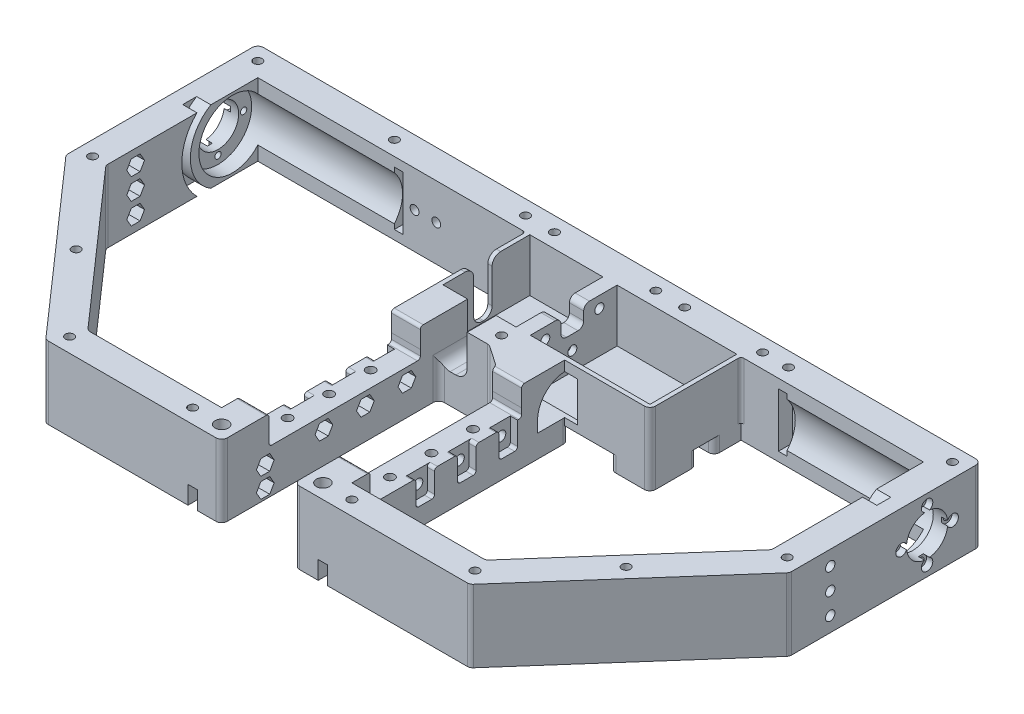
from build123d import *

# Parameters (mm, degrees)
BOSS_EXTRUDE1_DEPTH                     = 25.4
CUT_EXTRUDE1_REACH                      = 200.071
SKETCH3_R                               = 7.25
CUT_EXTRUDE2_DEPTH                      = 5.08
CUT_EXTRUDE3_START                      = -5.08
SKETCH4_R                               = 7.25
CUT_EXTRUDE3_DEPTH                      = 5.08
SKETCH5_R                               = 11.8
CUT_EXTRUDE4_DEPTH                      = 53
CUT_EXTRUDE5_START                      = -53
SKETCH6_R                               = 11.8
CUT_EXTRUDE5_DEPTH                      = 53
SKETCH9_W                               = 3
SKETCH9_H                               = 19
CUT_EXTRUDE8_DEPTH                      = 5
CUT_EXTRUDE9_DEPTH                      = 5
CUT_EXTRUDE10_START                     = -5
CUT_EXTRUDE10_DEPTH                     = 5
CBORE_FOR_M3_SBHCS1_D                   = 2.2
CBORE_FOR_M3_SBHCS1_DEPTH               = 5.08
CBORE_FOR_M3_SBHCS1_CBORE_D             = 4
CBORE_FOR_M3_SBHCS1_CBORE_DEPTH         = 2.2
CBORE_FOR_M3_SBHCS1_TIP                 = 0.660946681
CBORE_FOR_M3_SBHCS2_D                   = 2.2
CBORE_FOR_M3_SBHCS2_DEPTH               = 5.08
CBORE_FOR_M3_SBHCS2_CBORE_D             = 4
CBORE_FOR_M3_SBHCS2_CBORE_DEPTH         = 2.2
CBORE_FOR_M3_SBHCS2_TIP                 = 0.660946681
SKETCH17_W                              = 3.3
SKETCH17_H                              = 6.35
CUT_EXTRUDE11_DEPTH                     = 20.32
SKETCH19_W                              = 3.3
SKETCH19_H                              = 6.35
CUT_EXTRUDE12_DEPTH                     = 20.32
SKETCH20_W                              = 10.16
SKETCH20_H                              = 7.65
CUT_EXTRUDE13_DEPTH                     = 1.65
SKETCH21_W                              = 10.16
SKETCH21_H                              = 7.65
CUT_EXTRUDE14_DEPTH                     = 1.65
SKETCH22_R                              = 1.65
CUT_EXTRUDE15_DEPTH                     = 8.51
CUT_EXTRUDE16_START                     = -8.51
SKETCH23_R                              = 1.65
CUT_EXTRUDE16_DEPTH                     = 8.51
CUT_EXTRUDE17_DEPTH                     = 4.1
CUT_EXTRUDE18_DEPTH                     = 4.1
SKETCH26_R                              = 1.65
CUT_EXTRUDE19_DEPTH                     = 10.16
CUT_EXTRUDE20_START                     = -10.16
SKETCH27_R                              = 1.65
CUT_EXTRUDE20_DEPTH                     = 10.16
CUT_EXTRUDE21_DEPTH                     = 4.1
CUT_EXTRUDE22_DEPTH                     = 4.1
SKETCH30_W                              = 5
SKETCH30_H                              = 20
BOSS_EXTRUDE2_DEPTH                     = 30.479681711
CBORE_FOR_M3_SBHCS3_D                   = 3.2
CBORE_FOR_M3_SBHCS3_DEPTH               = 5
CBORE_FOR_M3_SBHCS3_CBORE_D             = 6
CBORE_FOR_M3_SBHCS3_CBORE_DEPTH         = 0.5
CBORE_FOR_M3_SBHCS3_TIP                 = 0.96137699
CBORE_FOR_M3_SBHCS4_D                   = 3.2
CBORE_FOR_M3_SBHCS4_DEPTH               = 5
CBORE_FOR_M3_SBHCS4_CBORE_D             = 6
CBORE_FOR_M3_SBHCS4_CBORE_DEPTH         = 3
CBORE_FOR_M3_SBHCS4_TIP                 = 0.96137699
SKETCH35_W                              = 8
SKETCH35_H                              = 7
CUT_EXTRUDE23_DEPTH                     = 5
FILLET1_R                               = 2
SKETCH36_W                              = 30.479681711
SKETCH36_H                              = 1.5
BOSS_EXTRUDE3_DEPTH                     = 27.16
SKETCH37_W                              = 1.5
SKETCH37_H                              = 30.479681711
BOSS_EXTRUDE4_DEPTH                     = 18.5
SKETCH38_W                              = 6.5
SKETCH38_H                              = 18
CUT_EXTRUDE24_DEPTH                     = 1.5
FILLET2_R                               = 3
SKETCH39_W                              = 30.479681711
SKETCH39_H                              = 1.5
BOSS_EXTRUDE5_DEPTH                     = 43.5
SKETCH40_W                              = 1.5
SKETCH40_H                              = 30.479681711
BOSS_EXTRUDE9_DEPTH                     = 18.5
SKETCH41_W                              = 29.940168914
SKETCH41_H                              = 1.5
BOSS_EXTRUDE7_DEPTH                     = 20
SKETCH42_W                              = 5
SKETCH42_H                              = 5
BOSS_EXTRUDE8_DEPTH                     = 5.4
SKETCH44_W                              = 18
SKETCH44_H                              = 14
CUT_EXTRUDE25_DEPTH                     = 11
F_1_0MM_DOWEL_HOLE1_D                   = 4.6
F_1_0MM_DOWEL_HOLE1_DEPTH               = 25.4
F_1_0MM_DOWEL_HOLE1_TIP                 = 1.381979424
F_1_0MM_DOWEL_HOLE2_D                   = 3.2
F_1_0MM_DOWEL_HOLE2_DEPTH               = 15.4
F_1_0MM_DOWEL_HOLE2_TIP                 = 0.96137699
SKETCH49_W                              = 10
SKETCH49_H                              = 15
CUT_EXTRUDE26_DEPTH                     = 10.16
FILLET4_R                               = 4
F_3_0MM_DOWEL_HOLE1_D                   = 3
F_3_0MM_DOWEL_HOLE1_DEPTH               = 25.4
F_3_0MM_DOWEL_HOLE1_TIP                 = 0.901290929
CBORE_FOR_M8_HEX_HEAD_BOLT1_D           = 3.1
CBORE_FOR_M8_HEX_HEAD_BOLT1_DEPTH       = 10.16
CBORE_FOR_M8_HEX_HEAD_BOLT1_CBORE_D     = 6
CBORE_FOR_M8_HEX_HEAD_BOLT1_CBORE_DEPTH = 5
CBORE_FOR_M8_HEX_HEAD_BOLT1_TIP         = 0.931333959
CUT_EXTRUDE27_DEPTH                     = 2.54
CUT_EXTRUDE28_START                     = -2.54
CUT_EXTRUDE28_DEPTH                     = 2.54
F_3_0MM_DOWEL_HOLE3_D                   = 3.4
F_3_0MM_DOWEL_HOLE3_DEPTH               = 7.62
F_3_0MM_DOWEL_HOLE3_TIP                 = 1.021463052
F_3_0MM_DOWEL_HOLE4_D                   = 3.4
F_3_0MM_DOWEL_HOLE4_DEPTH               = 7.62
F_3_0MM_DOWEL_HOLE4_TIP                 = 1.021463052
FILLET5_R                               = 1
FILLET6_R                               = 1
CUT_EXTRUDE29_DEPTH                     = 4.1
CUT_EXTRUDE30_DEPTH                     = 4.1
FILLET7_R                               = 1
SKETCH63_W                              = 75.66
SKETCH63_H                              = 9.479681711
BOSS_EXTRUDE10_DEPTH                    = 5.4
FILLET8_R                               = 2
FILLET9_R                               = 10


with BuildPart() as part:
    # Sketch1 → Boss-Extrude1 (new body)
    with BuildSketch(Plane(origin=(0, 0, 0), x_dir=(1, 0, 0), z_dir=(0, 1, 0))):
        Polygon((127, 0), (-127, 0), (-127, -67.34), (-74.439915543, -126.999681711), (-12.699915543, -126.999681711), (-12.699915543, -50.799681711), (5.082704288, -50.799681711), (12.699915543, -56.051038982), (12.699915543, -126.999681711), (74.439915543, -126.999681711), (127, -67.34), align=None)
        Polygon((-116.84, -10.16), (-116.84, -63.502882235), (-69.85036471, -116.839681711), (-22.859915543, -116.839681711), (-22.859915543, -40.639681711), (22.859915543, -40.639681711), (22.859915543, -116.839681711), (69.85036471, -116.839681711), (116.84, -63.502882235), (116.84, -10.16), align=None, mode=Mode.SUBTRACT)
    extrude(amount=BOSS_EXTRUDE1_DEPTH)

    # Cut-Extrude1: up to this face of the body (flat: up to its plane)
    cut_extrude1_end = Plane(part.part.faces().sort_by_distance((22.859915543, 12.7, 78.739681711))[0])
    # Sketch2 → Cut-Extrude1 (cut, up to the picked face)
    with BuildSketch(Plane.ZY.offset(22.859915543), mode=Mode.PRIVATE) as cut_extrude1_sk1:
        Polygon((57.248685399, 15.4), (110.390678023, 15.4), (110.393379129, 18.4), (110.393379129, 25.4), (57.245984293, 25.4), (57.245984293, 18.4), align=None)
    cut_extrude1_tool1 = split(extrude(cut_extrude1_sk1.sketch, amount=-CUT_EXTRUDE1_REACH, mode=Mode.PRIVATE), bisect_by=cut_extrude1_end, keep=Keep.BOTH, mode=Mode.PRIVATE)
    add(cut_extrude1_tool1.solids().sort_by(Axis((-22.859916, 20.400061, 83.819682), (1, 0, 0)))[0], mode=Mode.SUBTRACT)

    # Sketch3 → Cut-Extrude2 (cut)
    with BuildSketch(Plane(origin=(127, 0, 0), x_dir=(0, 0, -1), z_dir=(1, 0, 0))):
        with Locations((-19.05, 12.7)):
            Circle(SKETCH3_R)
    extrude(amount=-CUT_EXTRUDE2_DEPTH, mode=Mode.SUBTRACT)

    # Sketch4 → Cut-Extrude3 (cut)
    with BuildSketch(Plane.ZY.offset(127).offset(CUT_EXTRUDE3_START)):
        with Locations(Location((19.05, 12.7, 0), (0, 0, 180))):
            Circle(SKETCH4_R)
    extrude(amount=CUT_EXTRUDE3_DEPTH, mode=Mode.SUBTRACT)

    # Sketch5 → Cut-Extrude4 (cut)
    with BuildSketch(Plane(origin=(121.92, 0, 0), x_dir=(0, 0, -1), z_dir=(1, 0, 0))):
        with Locations((-19.05, 12.7)):
            Circle(SKETCH5_R)
    extrude(amount=-CUT_EXTRUDE4_DEPTH, mode=Mode.SUBTRACT)

    # Sketch6 → Cut-Extrude5 (cut)
    with BuildSketch(Plane.ZY.offset(121.92).offset(CUT_EXTRUDE5_START)):
        with Locations(Location((19.05, 12.7, 0), (0, 0, 180))):
            Circle(SKETCH6_R)
    extrude(amount=CUT_EXTRUDE5_DEPTH, mode=Mode.SUBTRACT)

    # Sketch9 → Cut-Extrude8 (cut)
    with BuildSketch(Plane.XY.offset(10.16)):
        with Locations((-67.42, 12.7)):
            Rectangle(SKETCH9_W, SKETCH9_H)
        with Locations((67.42, 12.7)):
            Rectangle(SKETCH9_W, SKETCH9_H)
    extrude(amount=-CUT_EXTRUDE8_DEPTH, mode=Mode.SUBTRACT)

    # Sketch10 → Cut-Extrude9 (cut)
    with BuildSketch(Plane.ZY.offset(-116.84)):
        with BuildLine():
            Line((31.52196857, 0), (26.649342077, 0))
            ThreePointArc((26.649342077, 0), (33.85, 12.7), (26.649342077, 25.4))
            Line((26.649342077, 25.4), (31.52196857, 25.4))
            ThreePointArc((31.52196857, 25.4), (36.85, 12.7), (31.52196857, 0))
        make_face()
    extrude(amount=-CUT_EXTRUDE9_DEPTH, mode=Mode.SUBTRACT)

    # Sketch11 → Cut-Extrude10 (cut)
    with BuildSketch(Plane(origin=(-116.84, 0, 0), x_dir=(0, 0, -1), z_dir=(1, 0, 0)).offset(CUT_EXTRUDE10_START)):
        with BuildLine():
            Line((-31.52196857, 0), (-26.649342077, 0))
            ThreePointArc((-26.649342077, 0), (-33.85, 12.7), (-26.649342077, 25.4))
            Line((-26.649342077, 25.4), (-31.52196857, 25.4))
            ThreePointArc((-31.52196857, 25.4), (-36.85, 12.7), (-31.52196857, 0))
        make_face()
    extrude(amount=CUT_EXTRUDE10_DEPTH, mode=Mode.SUBTRACT)

    # CBORE for M3 SBHCS1
    with Locations(Plane(origin=(127, 12.7, 28.05), x_dir=(0, 0, 1), z_dir=(1, 0, 0))):
        with Locations((0, 0), (-9, -9), (-18, 0), (-9, 9)):
            CounterBoreHole(CBORE_FOR_M3_SBHCS1_D / 2, CBORE_FOR_M3_SBHCS1_CBORE_D / 2, CBORE_FOR_M3_SBHCS1_CBORE_DEPTH, depth=CBORE_FOR_M3_SBHCS1_DEPTH)
            with Locations((0, 0, -(CBORE_FOR_M3_SBHCS1_DEPTH + CBORE_FOR_M3_SBHCS1_TIP / 2))):  # 118° drill point
                Cone(0, CBORE_FOR_M3_SBHCS1_D / 2, CBORE_FOR_M3_SBHCS1_TIP, mode=Mode.SUBTRACT)

    # CBORE for M3 SBHCS2
    with Locations(Plane(origin=(-127, 12.7, 28.05), x_dir=(0, 0, -1), z_dir=(-1, 0, 0))):
        with Locations((0, 0), (9, -9), (18, 0), (9, 9)):
            CounterBoreHole(CBORE_FOR_M3_SBHCS2_D / 2, CBORE_FOR_M3_SBHCS2_CBORE_D / 2, CBORE_FOR_M3_SBHCS2_CBORE_DEPTH, depth=CBORE_FOR_M3_SBHCS2_DEPTH)
            with Locations((0, 0, -(CBORE_FOR_M3_SBHCS2_DEPTH + CBORE_FOR_M3_SBHCS2_TIP / 2))):  # 118° drill point
                Cone(0, CBORE_FOR_M3_SBHCS2_D / 2, CBORE_FOR_M3_SBHCS2_TIP, mode=Mode.SUBTRACT)

    # Sketch17 → Cut-Extrude11 (cut)
    with BuildSketch(Plane.XY.offset(126.999681711)):
        with Locations((22.859915543, 3.175)):
            Rectangle(SKETCH17_W, SKETCH17_H)
    extrude(amount=-CUT_EXTRUDE11_DEPTH, mode=Mode.SUBTRACT)

    # Sketch19 → Cut-Extrude12 (cut)
    with BuildSketch(Plane.XY.offset(126.999681711)):
        with Locations((-22.859915543, 3.175)):
            Rectangle(SKETCH19_W, SKETCH19_H)
    extrude(amount=-CUT_EXTRUDE12_DEPTH, mode=Mode.SUBTRACT)

    # Sketch20 → Cut-Extrude13 (cut)
    with BuildSketch(Plane(origin=(22.859915543, 0, 0), x_dir=(0, 0, -1), z_dir=(1, 0, 0))):
        with Locations((-111.759681711, 10.175)):
            Rectangle(SKETCH20_W, SKETCH20_H)
    extrude(amount=-CUT_EXTRUDE13_DEPTH, mode=Mode.SUBTRACT)

    # Sketch21 → Cut-Extrude14 (cut)
    with BuildSketch(Plane.ZY.offset(22.859915543)):
        with Locations((111.759681711, 10.175)):
            Rectangle(SKETCH21_W, SKETCH21_H)
    extrude(amount=-CUT_EXTRUDE14_DEPTH, mode=Mode.SUBTRACT)

    # Sketch22 → Cut-Extrude15 (cut)
    with BuildSketch(Plane(origin=(21.209915543, 0, 0), x_dir=(0, 0, -1), z_dir=(1, 0, 0))):
        with Locations((-111.679681711, 3.5)):
            Circle(SKETCH22_R)
        with Locations((-111.679681711, 10.5)):
            Circle(SKETCH22_R)
    extrude(amount=-CUT_EXTRUDE15_DEPTH, mode=Mode.SUBTRACT)

    # Sketch23 → Cut-Extrude16 (cut)
    with BuildSketch(Plane.ZY.offset(21.209915543).offset(CUT_EXTRUDE16_START)):
        with Locations(Location((111.679681711, 3.5, 0), (0, 0, 180))):
            Circle(SKETCH23_R)
        with Locations(Location((111.679681711, 10.5, 0), (0, 0, 180))):
            Circle(SKETCH23_R)
    extrude(amount=CUT_EXTRUDE16_DEPTH, mode=Mode.SUBTRACT)

    # Sketch24 → Cut-Extrude17 (cut)
    with BuildSketch(Plane.ZY.offset(-12.699915543)):
        Polygon((114.797373165, 10.5), (113.238527438, 13.2), (110.120835984, 13.2), (108.561990258, 10.5), (110.120835984, 7.8), (113.238527438, 7.8), align=None)
        Polygon((114.797373165, 3.5), (113.238527438, 6.2), (110.120835984, 6.2), (108.561990258, 3.5), (110.120835984, 0.8), (113.238527438, 0.8), align=None)
    extrude(amount=-CUT_EXTRUDE17_DEPTH, mode=Mode.SUBTRACT)

    # Sketch25 → Cut-Extrude18 (cut)
    with BuildSketch(Plane(origin=(-12.699915543, 0, 0), x_dir=(0, 0, -1), z_dir=(1, 0, 0))):
        Polygon((-108.561990258, 10.5), (-110.120835984, 13.2), (-113.238527438, 13.2), (-114.797373165, 10.5), (-113.238527438, 7.8), (-110.120835984, 7.8), align=None)
        Polygon((-108.561990258, 3.5), (-110.120835984, 6.2), (-113.238527438, 6.2), (-114.797373165, 3.5), (-113.238527438, 0.8), (-110.120835984, 0.8), align=None)
    extrude(amount=-CUT_EXTRUDE18_DEPTH, mode=Mode.SUBTRACT)

    # Sketch26 → Cut-Extrude19 (cut)
    with BuildSketch(Plane(origin=(127, 0, 0), x_dir=(0, 0, -1), z_dir=(1, 0, 0))):
        with Locations((-53.05, 20.2)):
            Circle(SKETCH26_R)
        with Locations((-53.05, 12.7)):
            Circle(SKETCH26_R)
        with Locations((-53.05, 5.2)):
            Circle(SKETCH26_R)
    extrude(amount=-CUT_EXTRUDE19_DEPTH, mode=Mode.SUBTRACT)

    # Sketch27 → Cut-Extrude20 (cut)
    with BuildSketch(Plane.ZY.offset(127).offset(CUT_EXTRUDE20_START)):
        with Locations(Location((53.05, 20.2, 0), (0, 0, 180))):
            Circle(SKETCH27_R)
        with Locations(Location((53.05, 12.7, 0), (0, 0, 180))):
            Circle(SKETCH27_R)
        with Locations(Location((53.05, 5.2, 0), (0, 0, 180))):
            Circle(SKETCH27_R)
    extrude(amount=CUT_EXTRUDE20_DEPTH, mode=Mode.SUBTRACT)

    # Sketch28 → Cut-Extrude21 (cut)
    with BuildSketch(Plane.ZY.offset(-116.84)):
        Polygon((56.167691454, 20.2), (54.608845727, 22.9), (51.491154273, 22.9), (49.932308546, 20.2), (51.491154273, 17.5), (54.608845727, 17.5), align=None)
        Polygon((51.491154273, 15.4), (49.932308546, 12.7), (51.491154273, 10), (54.608845727, 10), (56.167691454, 12.7), (54.608845727, 15.4), align=None)
        Polygon((51.491154273, 7.9), (49.932308546, 5.2), (51.491154273, 2.5), (54.608845727, 2.5), (56.167691454, 5.2), (54.608845727, 7.9), align=None)
    extrude(amount=-CUT_EXTRUDE21_DEPTH, mode=Mode.SUBTRACT)

    # Sketch29 → Cut-Extrude22 (cut)
    with BuildSketch(Plane(origin=(-116.84, 0, 0), x_dir=(0, 0, -1), z_dir=(1, 0, 0))):
        Polygon((-49.932308546, 20.2), (-51.491154273, 22.9), (-54.608845727, 22.9), (-56.167691454, 20.2), (-54.608845727, 17.5), (-51.491154273, 17.5), align=None)
        Polygon((-56.167691454, 12.7), (-54.608845727, 10), (-51.491154273, 10), (-49.932308546, 12.7), (-51.491154273, 15.4), (-54.608845727, 15.4), align=None)
        Polygon((-56.167691454, 5.2), (-54.608845727, 2.5), (-51.491154273, 2.5), (-49.932308546, 5.2), (-51.491154273, 7.9), (-54.608845727, 7.9), align=None)
    extrude(amount=-CUT_EXTRUDE22_DEPTH, mode=Mode.SUBTRACT)

    # Sketch30 → Boss-Extrude2 (add)
    with BuildSketch(Plane(origin=(0, 0, 40.639681711), x_dir=(-1, 0, 0), z_dir=(0, 0, -1))):
        with Locations((-6.800084457, 15.4)):
            Rectangle(SKETCH30_W, SKETCH30_H)
    extrude(amount=BOSS_EXTRUDE2_DEPTH)

    # CBORE for M3 SBHCS3
    with Locations(Plane(origin=(4.300084457, 21.4, 35.399681711), x_dir=(0, -1, 0), z_dir=(-1, 0, 0))):
        with Locations((0, 0), (0, -19)):
            CounterBoreHole(CBORE_FOR_M3_SBHCS3_D / 2, CBORE_FOR_M3_SBHCS3_CBORE_D / 2, CBORE_FOR_M3_SBHCS3_CBORE_DEPTH, depth=CBORE_FOR_M3_SBHCS3_DEPTH)
            with Locations((0, 0, -(CBORE_FOR_M3_SBHCS3_DEPTH + CBORE_FOR_M3_SBHCS3_TIP / 2))):  # 118° drill point
                Cone(0, CBORE_FOR_M3_SBHCS3_D / 2, CBORE_FOR_M3_SBHCS3_TIP, mode=Mode.SUBTRACT)

    # CBORE for M3 SBHCS4
    with Locations(Plane(origin=(4.300084457, 13.4, 25.899681711), x_dir=(0, -1, 0), z_dir=(-1, 0, 0))):
        with Locations((0, 0)):
            CounterBoreHole(CBORE_FOR_M3_SBHCS4_D / 2, CBORE_FOR_M3_SBHCS4_CBORE_D / 2, CBORE_FOR_M3_SBHCS4_CBORE_DEPTH, depth=CBORE_FOR_M3_SBHCS4_DEPTH)
            with Locations((0, 0, -(CBORE_FOR_M3_SBHCS4_DEPTH + CBORE_FOR_M3_SBHCS4_TIP / 2))):  # 118° drill point
                Cone(0, CBORE_FOR_M3_SBHCS4_D / 2, CBORE_FOR_M3_SBHCS4_TIP, mode=Mode.SUBTRACT)

    # Sketch35 → Cut-Extrude23 (cut)
    with BuildSketch(Plane.ZY.offset(-4.300084457)):
        with Locations((25.899840856, 21.9)):
            Rectangle(SKETCH35_W, SKETCH35_H)
    extrude(amount=-CUT_EXTRUDE23_DEPTH, mode=Mode.SUBTRACT)

    # Fillet1
    fillet1_edges = [part.edges().sort_by_distance(p)[0] for p in [
        (6.800084457, 25.4, 21.899840856),
        (6.800084457, 25.4, 29.899840856),
        (6.800084457, 18.4, 29.899840856),
        (6.800084457, 18.4, 21.899840856),
    ]]
    fillet(fillet1_edges, radius=FILLET1_R)

    # Sketch36 → Boss-Extrude3 (add)
    with BuildSketch(Plane.ZY.offset(-4.300084457)):
        with Locations((25.399840856, 6.15)):
            Rectangle(SKETCH36_W, SKETCH36_H)
    extrude(amount=BOSS_EXTRUDE3_DEPTH)

    # Sketch37 → Boss-Extrude4 (add)
    with BuildSketch(Plane(origin=(0, 6.9, 0), x_dir=(1, 0, 0), z_dir=(0, 1, 0))):
        with Locations((-22.109915543, -25.399840856)):
            Rectangle(SKETCH37_W, SKETCH37_H)
    extrude(amount=BOSS_EXTRUDE4_DEPTH)

    # Sketch38 → Cut-Extrude24 (cut)
    with BuildSketch(Plane.ZY.offset(22.859915543)):
        with Locations((26.639681711, 16.4)):
            Rectangle(SKETCH38_W, SKETCH38_H)
    extrude(amount=-CUT_EXTRUDE24_DEPTH, mode=Mode.SUBTRACT)

    # Fillet2
    fillet2_edges = [part.edges().sort_by_distance(p)[0] for p in [
        (-22.109915543, 25.4, 23.389681711),
        (-22.109915543, 25.4, 29.889681711),
        (-22.109915543, 7.4, 29.889681711),
        (-22.109915543, 7.4, 23.389681711),
    ]]
    fillet(fillet2_edges, radius=FILLET2_R)



with BuildPart() as body_2:
    # Sketch39 → Boss-Extrude5 (new body)
    with BuildSketch(Plane(origin=(9.300084457, 0, 0), x_dir=(0, 0, -1), z_dir=(1, 0, 0))):
        with Locations((-25.399840856, 6.15)):
            Rectangle(SKETCH39_W, SKETCH39_H)
    extrude(amount=BOSS_EXTRUDE5_DEPTH)


with BuildPart() as part_1:
    add(part.part)

    add(body_2.part)  # Boss-Extrude9 merges body 2
    # Sketch40 → Boss-Extrude9 (add)
    with BuildSketch(Plane(origin=(0, 6.9, 0), x_dir=(1, 0, 0), z_dir=(0, 1, 0))):
        with Locations((52.050084457, -25.399840856)):
            Rectangle(SKETCH40_W, SKETCH40_H)
    extrude(amount=BOSS_EXTRUDE9_DEPTH)

    # Sketch41 → Boss-Extrude7 (add)
    with BuildSketch(Plane.XZ.offset(-5.4)):
        with Locations((37.83, 41.389681711)):
            Rectangle(SKETCH41_W, SKETCH41_H)
    extrude(amount=-BOSS_EXTRUDE7_DEPTH)

    # Sketch42 → Boss-Extrude8 (add)
    with BuildSketch(Plane.XZ.offset(-5.4)):
        with Locations((50.300084457, 39.639681711)):
            Rectangle(SKETCH42_W, SKETCH42_H)
    extrude(amount=BOSS_EXTRUDE8_DEPTH)

    # Sketch44 → Cut-Extrude25 (cut)
    with BuildSketch(Plane(origin=(0, 0, 40.639681711), x_dir=(-1, 0, 0), z_dir=(0, 0, -1))):
        with Locations((-18.300084457, 14.9)):
            Rectangle(SKETCH44_W, SKETCH44_H)
    extrude(amount=-CUT_EXTRUDE25_DEPTH, mode=Mode.SUBTRACT)

    # Ø1.0mm Dowel Hole1
    with Locations(Plane(origin=(-17.779915543, 25.4, 121.919681711), x_dir=(0, 0, 1), z_dir=(0, 1, 0))):
        with Locations((0, 0), (0, 35.559831086)):
            Hole(F_1_0MM_DOWEL_HOLE1_D / 2, depth=F_1_0MM_DOWEL_HOLE1_DEPTH)
            with Locations((0, 0, -(F_1_0MM_DOWEL_HOLE1_DEPTH + F_1_0MM_DOWEL_HOLE1_TIP / 2))):  # 118° drill point
                Cone(0, F_1_0MM_DOWEL_HOLE1_D / 2, F_1_0MM_DOWEL_HOLE1_TIP, mode=Mode.SUBTRACT)

    # Ø1.0mm Dowel Hole2
    with Locations(Plane(origin=(-18.132800264, 15.4, 69.250678023), x_dir=(0, 0, 1), z_dir=(0, 1, 0))):
        with Locations((0, 0), (14.57, 0), (29.14, 0), (29.14, 35.912715807), (14.57, 35.912715807), (0, 35.912715807)):
            Hole(F_1_0MM_DOWEL_HOLE2_D / 2, depth=F_1_0MM_DOWEL_HOLE2_DEPTH)
            with Locations((0, 0, -(F_1_0MM_DOWEL_HOLE2_DEPTH + F_1_0MM_DOWEL_HOLE2_TIP / 2))):  # 118° drill point
                Cone(0, F_1_0MM_DOWEL_HOLE2_D / 2, F_1_0MM_DOWEL_HOLE2_TIP, mode=Mode.SUBTRACT)

    # Sketch49 → Cut-Extrude26 (cut)
    with BuildSketch(Plane.XY.offset(50.799681711)):
        with Locations((-7.699915543, 17.9)):
            Rectangle(SKETCH49_W, SKETCH49_H)
    extrude(amount=-CUT_EXTRUDE26_DEPTH, mode=Mode.SUBTRACT)

    # Fillet4
    fillet4_edges = [part_1.edges().sort_by_distance(p)[0] for p in [
        (-2.699915543, 10.4, 45.719681711),
        (-12.699915543, 10.4, 45.719681711),
    ]]
    fillet(fillet4_edges, radius=FILLET4_R)

    # Ø3.0mm Dowel Hole1
    with Locations(Plane(origin=(-27.937963258, 25.4, 121.919681711), x_dir=(0, 0, 1), z_dir=(0, 1, 0))):
        with Locations((0, 0), (0, -43.21), (-27.682634748, -68.59553394), (-58.839681711, -93.982036742), (-116.839681711, -93.982036742), (-116.839681711, -46.032036742), (-116.839681711, -0.002036742), (-116.839681711, 10.157963258), (-116.839681711, 45.717963258), (-116.839681711, 55.877963258), (-116.839681711, 83.237963258), (-116.839681711, 92.317963258), (-116.839681711, 149.857963258), (-58.839681711, 149.857963258), (-27.682634748, 124.471460456), (0, 99.085926516), (0, 55.877878801), (-76.2, 32.238047715)):
            Hole(F_3_0MM_DOWEL_HOLE1_D / 2, depth=F_3_0MM_DOWEL_HOLE1_DEPTH)
            with Locations((0, 0, -(F_3_0MM_DOWEL_HOLE1_DEPTH + F_3_0MM_DOWEL_HOLE1_TIP / 2))):  # 118° drill point
                Cone(0, F_3_0MM_DOWEL_HOLE1_D / 2, F_3_0MM_DOWEL_HOLE1_TIP, mode=Mode.SUBTRACT)

    # CBORE for M8 Hex Head Bolt1
    with Locations(Plane(origin=(-61.81, 12.7, 0), x_dir=(-1, 0, 0), z_dir=(0, 0, -1))):
        with Locations((0, 0), (-7.62, 0)):
            CounterBoreHole(CBORE_FOR_M8_HEX_HEAD_BOLT1_D / 2, CBORE_FOR_M8_HEX_HEAD_BOLT1_CBORE_D / 2, CBORE_FOR_M8_HEX_HEAD_BOLT1_CBORE_DEPTH, depth=CBORE_FOR_M8_HEX_HEAD_BOLT1_DEPTH)
            with Locations((0, 0, -(CBORE_FOR_M8_HEX_HEAD_BOLT1_DEPTH + CBORE_FOR_M8_HEX_HEAD_BOLT1_TIP / 2))):  # 118° drill point
                Cone(0, CBORE_FOR_M8_HEX_HEAD_BOLT1_D / 2, CBORE_FOR_M8_HEX_HEAD_BOLT1_TIP, mode=Mode.SUBTRACT)

    # Sketch54 → Cut-Extrude27 (cut)
    with BuildSketch(Plane.ZY.offset(22.859915543)):
        with BuildLine():
            Line((94.390678023, 15.4), (94.390678023, 7.4))
            ThreePointArc((94.390678023, 7.4), (94.097784804, 6.692893219), (93.390678023, 6.4))
            Line((93.390678023, 6.4), (88.820678023, 6.4))
            ThreePointArc((88.820678023, 6.4), (88.113571242, 6.692893219), (87.820678023, 7.4))
            Line((87.820678023, 7.4), (87.820678023, 15.4))
            Line((87.820678023, 15.4), (94.390678023, 15.4))
        make_face()
        with BuildLine():
            Line((73.250678023, 15.4), (73.250678023, 7.4))
            ThreePointArc((73.250678023, 7.4), (73.543571242, 6.692893219), (74.250678023, 6.4))
            Line((74.250678023, 6.4), (78.820678023, 6.4))
            ThreePointArc((78.820678023, 6.4), (79.527784804, 6.692893219), (79.820678023, 7.4))
            Line((79.820678023, 7.4), (79.820678023, 15.4))
            Line((79.820678023, 15.4), (73.250678023, 15.4))
        make_face()
        with BuildLine():
            Line((65.250678023, 15.4), (65.250678023, 7.4))
            ThreePointArc((65.250678023, 7.4), (64.957784804, 6.692893219), (64.250678023, 6.4))
            Line((64.250678023, 6.4), (59.680678023, 6.4))
            ThreePointArc((59.680678023, 6.4), (58.973571242, 6.692893219), (58.680678023, 7.4))
            Line((58.680678023, 7.4), (58.680678023, 15.4))
            Line((58.680678023, 15.4), (65.250678023, 15.4))
        make_face()
    extrude(amount=-CUT_EXTRUDE27_DEPTH, mode=Mode.SUBTRACT)

    # Sketch55 → Cut-Extrude28 (cut)
    with BuildSketch(Plane(origin=(22.859915543, 0, 0), x_dir=(0, 0, -1), z_dir=(1, 0, 0)).offset(CUT_EXTRUDE28_START)):
        with BuildLine():
            Line((-94.390678023, 15.4), (-94.390678023, 7.4))
            ThreePointArc((-94.390678023, 7.4), (-94.097784804, 6.692893219), (-93.390678023, 6.4))
            Line((-93.390678023, 6.4), (-88.820678023, 6.4))
            ThreePointArc((-88.820678023, 6.4), (-88.113571242, 6.692893219), (-87.820678023, 7.4))
            Line((-87.820678023, 7.4), (-87.820678023, 15.4))
            Line((-87.820678023, 15.4), (-94.390678023, 15.4))
        make_face()
        with BuildLine():
            Line((-73.250678023, 15.4), (-73.250678023, 7.4))
            ThreePointArc((-73.250678023, 7.4), (-73.543571242, 6.692893219), (-74.250678023, 6.4))
            Line((-74.250678023, 6.4), (-78.820678023, 6.4))
            ThreePointArc((-78.820678023, 6.4), (-79.527784804, 6.692893219), (-79.820678023, 7.4))
            Line((-79.820678023, 7.4), (-79.820678023, 15.4))
            Line((-79.820678023, 15.4), (-73.250678023, 15.4))
        make_face()
        with BuildLine():
            Line((-65.250678023, 15.4), (-65.250678023, 7.4))
            ThreePointArc((-65.250678023, 7.4), (-64.957784804, 6.692893219), (-64.250678023, 6.4))
            Line((-64.250678023, 6.4), (-59.680678023, 6.4))
            ThreePointArc((-59.680678023, 6.4), (-58.973571242, 6.692893219), (-58.680678023, 7.4))
            Line((-58.680678023, 7.4), (-58.680678023, 15.4))
            Line((-58.680678023, 15.4), (-65.250678023, 15.4))
        make_face()
    extrude(amount=CUT_EXTRUDE28_DEPTH, mode=Mode.SUBTRACT)

    # Ø3.0mm Dowel Hole3
    with Locations(Plane(origin=(-20.319915543, 10.9, 61.965678023), x_dir=(0, 0, -1), z_dir=(-1, 0, 0))):
        with Locations((0, 0), (-14.57, 0), (-29.14, 0)):
            Hole(F_3_0MM_DOWEL_HOLE3_D / 2, depth=F_3_0MM_DOWEL_HOLE3_DEPTH)
            with Locations((0, 0, -(F_3_0MM_DOWEL_HOLE3_DEPTH + F_3_0MM_DOWEL_HOLE3_TIP / 2))):  # 118° drill point
                Cone(0, F_3_0MM_DOWEL_HOLE3_D / 2, F_3_0MM_DOWEL_HOLE3_TIP, mode=Mode.SUBTRACT)

    # Ø3.0mm Dowel Hole4
    with Locations(Plane(origin=(20.319915543, 10.9, 91.105678023), x_dir=(0, 0, 1), z_dir=(1, 0, 0))):
        with Locations((0, 0), (-14.57, 0), (-29.14, 0)):
            Hole(F_3_0MM_DOWEL_HOLE4_D / 2, depth=F_3_0MM_DOWEL_HOLE4_DEPTH)
            with Locations((0, 0, -(F_3_0MM_DOWEL_HOLE4_DEPTH + F_3_0MM_DOWEL_HOLE4_TIP / 2))):  # 118° drill point
                Cone(0, F_3_0MM_DOWEL_HOLE4_D / 2, F_3_0MM_DOWEL_HOLE4_TIP, mode=Mode.SUBTRACT)

    # Fillet5
    fillet5_edges = [part_1.edges().sort_by_distance(p)[0] for p in [
        (-17.779915543, 25.4, 57.245984293),
        (17.779915543, 25.4, 57.245984293),
        (-17.779915543, 15.4, 57.248685399),
        (17.779915543, 15.4, 57.248685399),
        (-17.779915543, 15.4, 110.390678023),
        (17.779915543, 15.4, 110.390678023),
        (-17.779915543, 25.4, 110.393379129),
        (17.779915543, 25.4, 110.393379129),
    ]]
    fillet(fillet5_edges, radius=FILLET5_R)

    # Fillet6
    fillet6_edges = [part_1.edges().sort_by_distance(p)[0] for p in [
        (-21.589915543, 15.4, 87.820678023),
        (-21.589915543, 15.4, 94.390678023),
        (-21.589915543, 15.4, 73.250678023),
        (-21.589915543, 15.4, 79.820678023),
        (-21.589915543, 15.4, 65.250678023),
        (21.589915543, 15.4, 94.390678023),
        (21.589915543, 15.4, 87.820678023),
        (21.589915543, 15.4, 65.250678023),
        (21.589915543, 15.4, 79.820678023),
        (21.589915543, 15.4, 73.250678023),
    ]]
    fillet(fillet6_edges, radius=FILLET6_R)

    # Sketch61 → Cut-Extrude29 (cut)
    with BuildSketch(Plane(origin=(-12.699915543, 0, 0), x_dir=(0, 0, -1), z_dir=(1, 0, 0))):
        Polygon((-87.987986569, 10.9), (-89.546832296, 13.6), (-92.66452375, 13.6), (-94.223369477, 10.9), (-92.66452375, 8.2), (-89.546832296, 8.2), align=None)
        Polygon((-79.653369477, 10.9), (-78.09452375, 8.2), (-74.976832296, 8.2), (-73.417986569, 10.9), (-74.976832296, 13.6), (-78.09452375, 13.6), align=None)
        Polygon((-65.083369477, 10.9), (-63.52452375, 8.2), (-60.406832296, 8.2), (-58.847986569, 10.9), (-60.406832296, 13.6), (-63.52452375, 13.6), align=None)
    extrude(amount=-CUT_EXTRUDE29_DEPTH, mode=Mode.SUBTRACT)

    # Sketch62 → Cut-Extrude30 (cut)
    with BuildSketch(Plane.ZY.offset(-12.699915543)):
        Polygon((94.223369477, 10.9), (92.66452375, 13.6), (89.546832296, 13.6), (87.987986569, 10.9), (89.546832296, 8.2), (92.66452375, 8.2), align=None)
        Polygon((58.847986569, 10.9), (60.406832296, 8.2), (63.52452375, 8.2), (65.083369477, 10.9), (63.52452375, 13.6), (60.406832296, 13.6), align=None)
        Polygon((79.653369477, 10.9), (78.09452375, 13.6), (74.976832296, 13.6), (73.417986569, 10.9), (74.976832296, 8.2), (78.09452375, 8.2), align=None)
    extrude(amount=-CUT_EXTRUDE30_DEPTH, mode=Mode.SUBTRACT)

    # Fillet7
    fillet7_edges = [part_1.edges().sort_by_distance(p)[0] for p in [
        (-22.859915543, 15.4, 10.16),
        (52.800084457, 15.4, 10.16),
    ]]
    fillet(fillet7_edges, radius=FILLET7_R)

    # Sketch63 → Boss-Extrude10 (add)
    with BuildSketch(Plane.XZ.offset(-5.4)):
        Polygon((-22.859915543, 30.639681711), (38.800084457, 30.639681711), (38.800084457, 42.139681711), (47.800084457, 42.139681711), (47.800084457, 37.139681711), (52.800084457, 37.139681711), (52.800084457, 30.639681711), (52.800084457, 25.639681711), (-22.859915543, 25.639681711), align=None)
        with Locations((14.970084457, 14.899840856)):
            Rectangle(SKETCH63_W, SKETCH63_H)
    extrude(amount=BOSS_EXTRUDE10_DEPTH)

    # Fillet8
    fillet8_edges = [part_1.edges().sort_by_distance(p)[0] for p in [
        (52.800084457, 2.7, 19.639681711),
        (52.800084457, 2.7, 25.639681711),
        (-22.859915543, 2.7, 19.639681711),
        (-22.859915543, 2.7, 25.639681711),
        (-22.859915543, 2.7, 30.639681711),
        (38.800084457, 2.7, 30.639681711),
        (52.800084457, 12.7, 42.139681711),
        (38.800084457, 2.7, 42.139681711),
        (22.859915543, 2.7, 40.639681711),
        (-22.859915543, 2.7, 40.639681711),
        (-12.699915543, 7.2, 50.799681711),
        (12.699915543, 12.7, 56.051038982),
        (5.082704288, 12.7, 50.799681711),
        (127, 12.7, 0),
        (127, 12.7, 67.34),
        (74.439915543, 12.7, 126.999681711),
        (12.699915543, 12.7, 126.999681711),
        (-12.699915543, 12.7, 126.999681711),
        (-74.439915543, 12.7, 126.999681711),
        (-127, 12.7, 67.34),
        (-127, 12.7, 0),
        (116.84, 12.7, 63.502882235),
        (69.85036471, 12.7, 116.839681711),
        (-116.84, 12.7, 63.502882235),
        (-69.85036471, 12.7, 116.839681711),
    ]]
    fillet(fillet8_edges, radius=FILLET8_R)

    # Fillet9
    fillet9_edges = [part_1.edges().sort_by_distance(p)[0] for p in [
        (16.08, 21.9, 51.639681711),
    ]]
    fillet(fillet9_edges, radius=FILLET9_R)


solid = part_1.part
